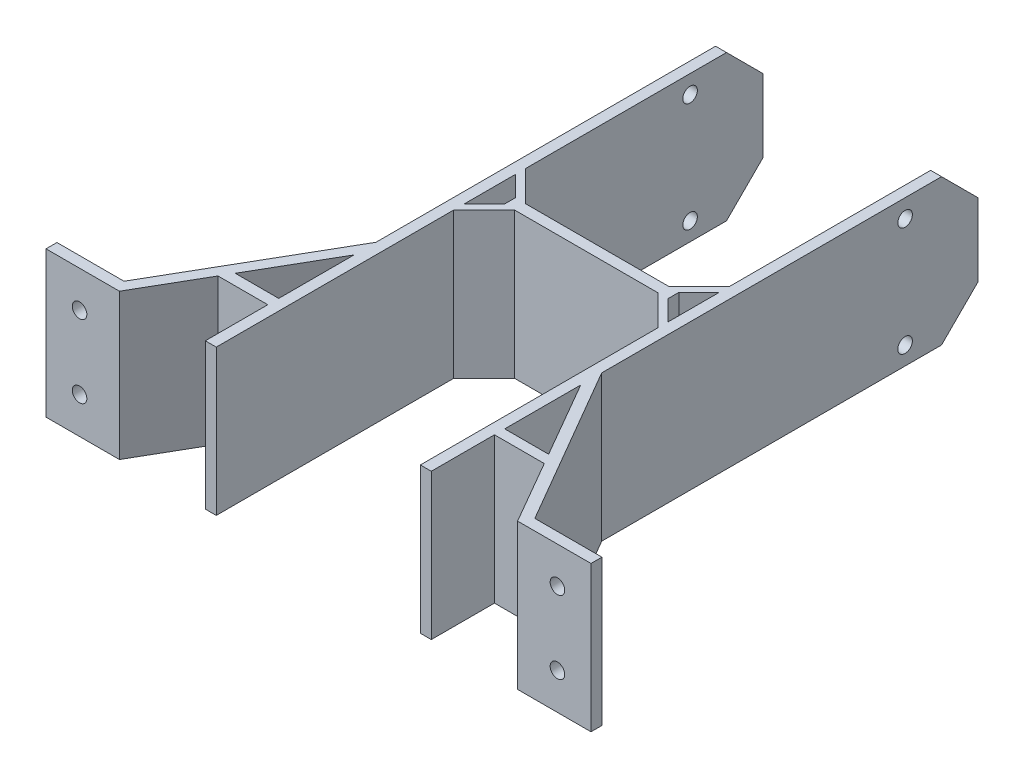
from build123d import *

# Parameters (mm, degrees)
SALIENTE_EXTRUIR1_DEPTH = 40
CROQUIS2_R              = 2
CORTAR_EXTRUIR1_DEPTH   = 136.646157054
CHAFL_N1_SIZE           = 10
CROQUIS3_R              = 2
CORTAR_EXTRUIR2_DEPTH   = 170.726624797


with BuildPart() as part:
    # Croquis1 → Saliente-Extruir1 (new body)
    with BuildSketch(Plane(origin=(0, 0, 0), x_dir=(1, 0, 0), z_dir=(0, 1, 0))):
        Polygon((-28, 9.865463386), (-19.634536614, 1.5), (19.634536614, 1.5), (28, 9.865463386), (28, 75), (31, 75), (31, -28.243978644), (56.40842741, -72), (74.820633284, -72), (74.820633284, -75), (54.676376602, -75), (44.669393136, -57.667396206), (31, -57.667396206), (31, -75), (28, -75), (28, -9.865463386), (19.634536614, -1.5), (-19.634536614, -1.5), (-28, -9.865463386), (-28, -75), (-31, -75), (-31, -57.856759015), (-44.669393136, -57.856759015), (-54.567047933, -75), (-74.711304615, -75), (-74.711304615, -72), (-56.299098741, -72), (-31, -28.180675596), (-31, 75), (-28, 75), align=None)
        Polygon((-28, -7.037036261), (-22.454974268, -1.492010529), (-22.454974268, 1.492010529), (-28, 7.037036261), align=None, mode=Mode.SUBTRACT)
        Polygon((28, -7.011712537), (22.454974268, -1.466686806), (22.454974268, 1.466686806), (28, 7.011712537), align=None, mode=Mode.SUBTRACT)
        Polygon((31, -33.991312786), (43.046670997, -54.856759015), (31, -54.856759015), align=None, mode=Mode.SUBTRACT)
        Polygon((-31, -34.180675596), (-42.937342328, -54.856759015), (-31, -54.856759015), align=None, mode=Mode.SUBTRACT)
    extrude(amount=SALIENTE_EXTRUIR1_DEPTH)

    # Croquis2 → Cortar-Extruir1 (cut, through all)
    with BuildSketch(Plane(origin=(31, 0, 0), x_dir=(0, 0, -1), z_dir=(1, 0, 0))):
        with Locations((55, 35)):
            Circle(CROQUIS2_R)
        with Locations((55, 5)):
            Circle(CROQUIS2_R)
    extrude(amount=-CORTAR_EXTRUIR1_DEPTH, mode=Mode.SUBTRACT)

    # Chaflán1
    chafl_n1_edges = [part.edges().sort_by_distance(p)[0] for p in [
        (-29.5, 40, -75),
        (-29.5, 0, -75),
        (29.5, 0, -75),
        (29.5, 40, -75),
    ]]
    chamfer(chafl_n1_edges, length=CHAFL_N1_SIZE)

    # Croquis3 → Cortar-Extruir2 (cut, through all)
    with BuildSketch(Plane(origin=(0, 0, 72), x_dir=(-1, 0, 0), z_dir=(0, 0, -1))):
        with Locations((-65.614530347, 30)):
            Circle(CROQUIS3_R)
        with Locations((-65.614530347, 10)):
            Circle(CROQUIS3_R)
        with Locations((65.505201678, 30)):
            Circle(CROQUIS3_R)
        with Locations((65.505201678, 10)):
            Circle(CROQUIS3_R)
    extrude(amount=-CORTAR_EXTRUIR2_DEPTH, mode=Mode.SUBTRACT)


solid = part.part
